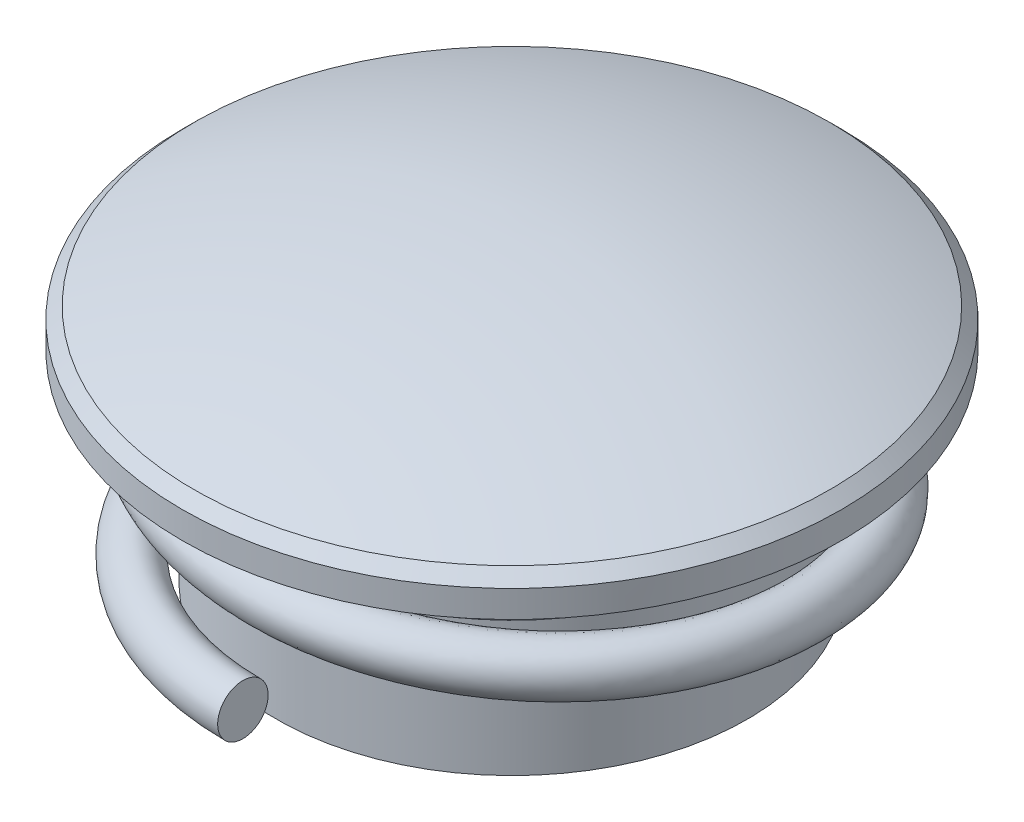
from build123d import *
from build123d.topology import SkipClean

# Parameters (mm, degrees)
SKETCH1_R           = 4.9
BOSS_EXTRUDE1_DEPTH = 0.5
DOME1_FACE_RADIUS   = 4.9
DOME1_HEIGHT        = 1
SKETCH2_R           = 1
BOSS_EXTRUDE2_DEPTH = 4
SKETCH3_R           = 3.5
BOSS_EXTRUDE3_DEPTH = 2
SWEEP1_PITCH        = 2.25
SWEEP1_HEIGHT       = 2.25
SWEEP1_RADIUS       = 4
SWEEP1_START_ANGLE  = -90
SKETCH7_R           = 0.375
SKETCH9_R           = 0.375
SKETCH11_R          = 0.375
SKETCH14_R          = 2
BOSS_EXTRUDE4_DEPTH = 0.2
CUT_EXTRUDE1_START  = -0.2
CUT_EXTRUDE1_DEPTH  = 0.2
FILLET1_R           = 0.3
CHAMFER1_SIZE       = 0.1


with BuildPart() as part:
    # Sketch1 → Boss-Extrude1 (new body)
    with BuildSketch(Plane(origin=(0, 0, 0), x_dir=(1, 0, 0), z_dir=(0, 1, 0))):
        with Locations(Location((0, 0, 0), (0, 0, 270))):
            Circle(SKETCH1_R)
    extrude(amount=BOSS_EXTRUDE1_DEPTH)

    # Dome1: a dome of height H over a round flat face of radius A is a cap of a sphere of radius (A * A + H * H) / (2 * H)
    dome1_r = (DOME1_FACE_RADIUS * DOME1_FACE_RADIUS + DOME1_HEIGHT * DOME1_HEIGHT) / (2 * DOME1_HEIGHT)
    dome1_base = Plane((0, 0.5, 0), z_dir=(0, 1, 0))
    with Locations(dome1_base.offset(DOME1_HEIGHT - dome1_r)):
        dome1_ball = Sphere(dome1_r, mode=Mode.PRIVATE)
    add(split(dome1_ball, bisect_by=dome1_base, keep=Keep.TOP, mode=Mode.PRIVATE))

    # Sketch2 → Boss-Extrude2 (add)
    with BuildSketch(Plane.XZ):
        with Locations(Location((0, 0, 0), (0, 0, 90))):
            Circle(SKETCH2_R)
    extrude(amount=BOSS_EXTRUDE2_DEPTH)

    # Sketch3 → Boss-Extrude3 (add)
    with BuildSketch(Plane(origin=(0, -3, 0), x_dir=(-1, 0, 0), z_dir=(0, -1, 0))):
        with Locations(Location((0, 0, 0), (0, 0, 90))):
            Circle(SKETCH3_R)
    extrude(amount=-BOSS_EXTRUDE3_DEPTH)

    # Sketch14 → Boss-Extrude4 (add)
    with BuildSketch(Plane(origin=(0, -3.5, 0), x_dir=(-1, 0, 0), z_dir=(0, -1, 0))):
        with Locations(Location((0, 0, 0), (0, 0, 90))):
            Circle(SKETCH14_R)
    extrude(amount=BOSS_EXTRUDE4_DEPTH)

    # Sketch15 → Cut-Extrude1 (cut)
    with SkipClean():  # the faces are left unmerged after this step: merging them gives an invalid solid
        with BuildSketch(Plane.XZ.offset(3.7).offset(CUT_EXTRUDE1_START)):
            with BuildLine():
                Line((0, 1), (0, 2))
                ThreePointArc((0, 2), (0.684040287, 1.879385242), (1.285575219, 1.532088886))
                Line((1.285575219, 1.532088886), (0.64278761, 0.766044443))
                ThreePointArc((0.64278761, 0.766044443), (0.342020143, 0.939692621), (0, 1))
            make_face()
        extrude(amount=CUT_EXTRUDE1_DEPTH, mode=Mode.SUBTRACT)

    # Fillet1
    fillet1_edges = [part.edges().sort_by_distance(p)[0] for p in [
        (1.285575219, -3.6, 1.532088886),
        (0, -3.6, 2),
    ]]
    fillet(fillet1_edges, radius=FILLET1_R)

    # Chamfer1
    # the kernel refuses this chamfer: 0.189326268, 0.1 mm, written as the material it takes off along each edge
    with BuildSketch(Plane(origin=(0, 0.5, 0), x_dir=(0, 0, 1), z_dir=(-1, 0, 0))) as chamfer1_piece_1:
        with BuildLine():
            Line((4.9, -CHAMFER1_SIZE), (4.728429871, 0.071570129))
            ThreePointArc((4.728429871, 0.071570129), (4.811116049, 0.037451532), (4.9, 0))
            Line((4.9, 0), (4.9, -CHAMFER1_SIZE))
        make_face()
    revolve(axis=Axis((0, 0.5, 0), (0, 1, 0)), mode=Mode.SUBTRACT)


with BuildPart() as body_2:
    # Sweep1: sweep along a helix
    with BuildLine() as sweep1_path:
        add(Helix(SWEEP1_PITCH, SWEEP1_HEIGHT, SWEEP1_RADIUS, center=(0, -0.375, 0), direction=(0, -1, 0), lefthand=True, mode=Mode.PRIVATE).rotate(Axis((0, -0.375, 0), (0, -1, 0)), SWEEP1_START_ANGLE))
    # Sketch7 → Sweep1 (sweep)
    with BuildSketch(Plane.XY):
        with Locations((-4, -0.375)):
            Circle(SKETCH7_R)
    sweep(path=sweep1_path.line, is_frenet=True)

    # Sweep2: sweep along a path in Sketch8
    with BuildLine(Plane(origin=(0, -0.375, 0), x_dir=(-1, 0, 0), z_dir=(0, -1, 0))) as sweep2_path:
        ThreePointArc((4, 0), (2.828427125, 2.828427125), (0, 4))
    # Sketch9 → Sweep2 (sweep)
    with BuildSketch(Plane(origin=(0, 0, 0), x_dir=(-1, 0, 0), z_dir=(0, 0, -1))):
        with Locations((4, -0.375)):
            Circle(SKETCH9_R)
    sweep(path=sweep2_path.line)

    # Sweep3: sweep along a path in Sketch10
    with BuildLine(Plane(origin=(0, -2.625, 0), x_dir=(-1, 0, 0), z_dir=(0, -1, 0))) as sweep3_path:
        ThreePointArc((0, -4), (2.828427125, -2.828427125), (4, 0))
    # Sketch11 → Sweep3 (sweep)
    with BuildSketch(Plane.XY):
        with Locations((-4, -2.625)):
            Circle(SKETCH11_R)
    sweep(path=sweep3_path.line)


solid = Compound([part.part, body_2.part])
